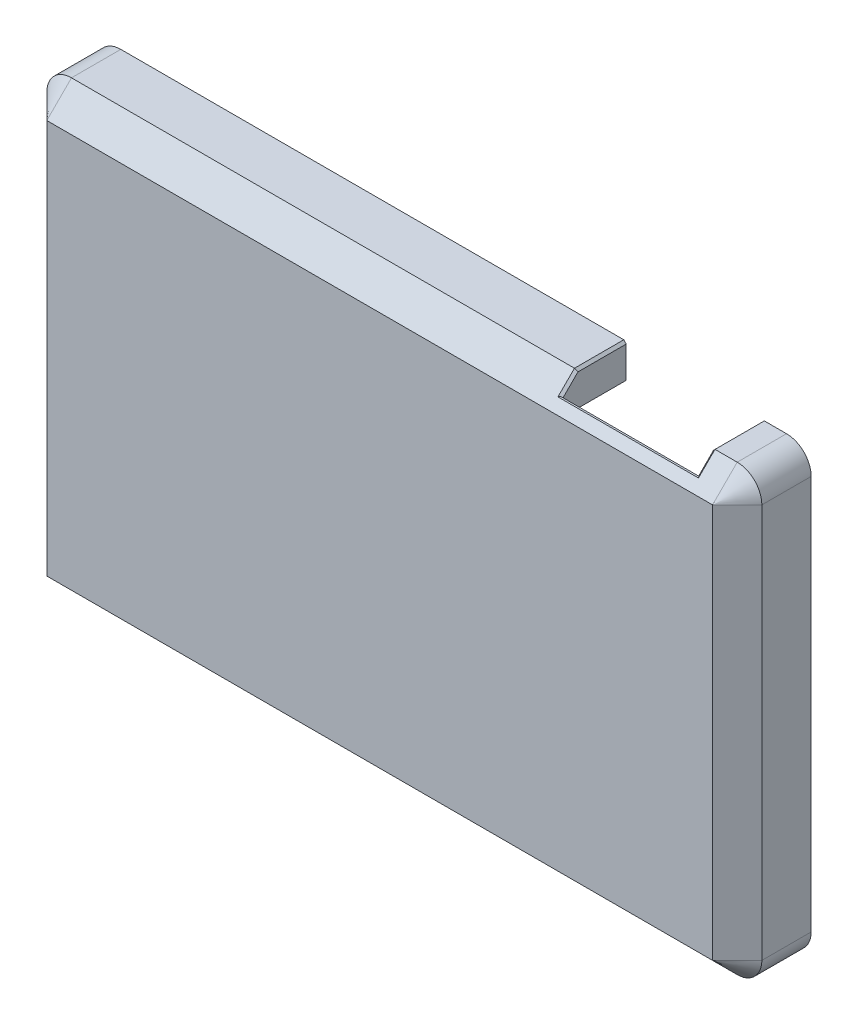
from build123d import *
from OCP.BRepFilletAPI import BRepFilletAPI_MakeChamfer

# Parameters (mm, degrees)
SKETCH_1_W          = 58
SKETCH_1_H          = 36
EXTRUDE_1_DEPTH     = 6
SKETCH_2_W          = 52.5
SKETCH_2_H          = 30.5
CUT_EXTRUDE_1_DEPTH = 5.2
FILLET_1_R          = 2
SKETCH_3_W          = 4
SKETCH_3_H          = 30.5
EXTRUDE_2_DEPTH     = 3.7
FILLET_2_R          = 4
CHAMFER_1_SIZE      = 2
SKETCH_4_W          = 11
SKETCH_4_H          = 5.2
CUT_EXTRUDE_2_DEPTH = 10
FILLET_3_R          = 0.2
CHAMFER_2_SIZE      = 0.2
CHAMFER_2_SIZE_2    = 0.141421356
M1_2X0_25_1_D       = 0.95
M1_2X0_25_1_DEPTH   = 3
M1_2X0_25_1_TIP     = 0.285408794


with BuildPart() as part:
    # 草图1 → 凸台-拉伸1 (new body)
    with BuildSketch(Plane.XY):
        Rectangle(SKETCH_1_W, SKETCH_1_H)
    extrude(amount=EXTRUDE_1_DEPTH)

    # 草图2 → 切除-拉伸1 (cut)
    with BuildSketch(Plane(origin=(0, 0, 0), x_dir=(-1, 0, 0), z_dir=(0, 0, -1))):
        Rectangle(SKETCH_2_W, SKETCH_2_H)
    extrude(amount=-CUT_EXTRUDE_1_DEPTH, mode=Mode.SUBTRACT)

    # 圆角1
    fillet_1_edges = [part.edges().sort_by_distance(p)[0] for p in [
        (29, -18, 3),
        (-29, -18, 3),
        (-29, 18, 3),
        (29, 18, 3),
    ]]
    fillet(fillet_1_edges, radius=FILLET_1_R)

    # 草图3 → 凸台-拉伸2 (add)
    with BuildSketch(Plane(origin=(0, 0, 5.2), x_dir=(-1, 0, 0), z_dir=(0, 0, -1))):
        with Locations((13.25, 0)):
            Rectangle(SKETCH_3_W, SKETCH_3_H)
    extrude(amount=EXTRUDE_2_DEPTH)

    # 圆角2
    fillet_2_edges = [part.edges().sort_by_distance(p)[0] for p in [
        (-15.25, -15.25, 3.35),
        (-15.25, 15.25, 3.35),
        (-11.25, 15.25, 3.35),
        (-11.25, -15.25, 3.35),
    ]]
    fillet(fillet_2_edges, radius=FILLET_2_R)

    # 倒角1
    chamfer_1_edges = [part.edges().sort_by_distance(p)[0] for p in [
        (-29, 0, 6),
        (0, 18, 6),
        (29, 0, 6),
        (0, -18, 6),
        (28.414213562, -17.414213562, 6),
        (28.414213562, 17.414213562, 6),
        (-28.414213562, -17.414213562, 6),
        (-28.414213562, 17.414213562, 6),
    ]]
    chamfer(chamfer_1_edges, length=CHAMFER_1_SIZE)

    # 草图4 → 切除-拉伸2 (cut)
    with BuildSketch(Plane(origin=(0, 18, 0), x_dir=(1, 0, 0), z_dir=(0, 1, 0))):
        with Locations((19.5, -2.6)):
            Rectangle(SKETCH_4_W, SKETCH_4_H)
    extrude(amount=-CUT_EXTRUDE_2_DEPTH, mode=Mode.SUBTRACT)

    # 圆角3
    fillet_3_edges = [part.edges().sort_by_distance(p)[0] for p in [
        (-26.25, 15.25, 2.6),
        (-26.25, -15.25, 2.6),
        (26.25, -15.25, 2.6),
        (26.25, 15.25, 2.6),
    ]]
    fillet(fillet_3_edges, radius=FILLET_3_R)

    # 倒角2
    chamfer_2_edges_1 = [part.edges().sort_by_distance(p)[0] for p in [
        (14, 17.4, 4.6),
        (25, 17.4, 4.6),
        (25, 18, 2),
        (14, 18, 2),
    ]]
    chamfer_2_edges_2 = [part.edges().sort_by_distance(p)[0] for p in [
        (19.5, 16.8, 5.2),
    ]]
    chamfer_2_side_2 = [part.faces().sort_by_distance(p)[0] for p in [
        (19.5, 16.797171573, 5.2),
    ]]
    chamfer_2 = BRepFilletAPI_MakeChamfer(part.part.solid().wrapped)
    for e in chamfer_2_edges_1:
        chamfer_2.Add(CHAMFER_2_SIZE - 0.0001, e.wrapped)
    for e in chamfer_2_edges_2:
        chamfer_2.Add(CHAMFER_2_SIZE_2 - 0.0001, CHAMFER_2_SIZE - 0.0001, e.wrapped, chamfer_2_side_2[0].wrapped)
    add(Compound.cast(chamfer_2.Shape()), mode=Mode.REPLACE)  # a hair under: the kernel refuses the full size

    # M1.2x0.25 螺纹孔1
    with Locations(Plane(origin=(27.5, 16.5, 0), x_dir=(-1, 0, 0), z_dir=(0, 0, -1))):
        with Locations((0, 0), (0, -33), (55, -33), (55, 0)):
            Hole(M1_2X0_25_1_D / 2, depth=M1_2X0_25_1_DEPTH)
            with Locations((0, 0, -(M1_2X0_25_1_DEPTH + M1_2X0_25_1_TIP / 2))):  # 118° drill point
                Cone(0, M1_2X0_25_1_D / 2, M1_2X0_25_1_TIP, mode=Mode.SUBTRACT)


solid = part.part
